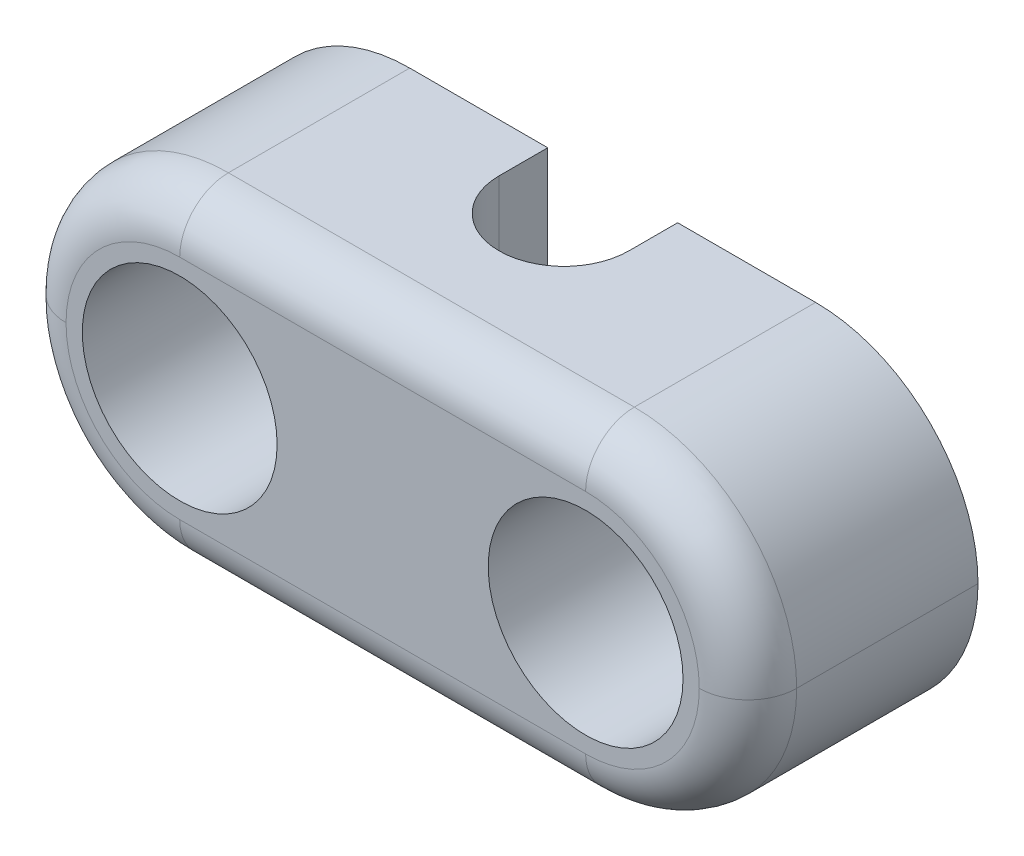
from build123d import *

# Parameters (mm, degrees)
SKETCH2_W                               = 45
SKETCH2_H                               = 20
BOSS_EXTRUDE2_DEPTH                     = 14.16787265
FILLET1_R                               = 10
CUT_EXTRUDE1_DEPTH                      = 22
CBORE_FOR_M5_HEX_HEAD_BOLT1_D           = 5.5
CBORE_FOR_M5_HEX_HEAD_BOLT1_CBORE_D     = 12
CBORE_FOR_M5_HEX_HEAD_BOLT1_CBORE_DEPTH = 10
FILLET2_R                               = 3


with BuildPart() as part:
    # Sketch2 → Boss-Extrude2 (new body)
    with BuildSketch(Plane.XY):
        Rectangle(SKETCH2_W, SKETCH2_H)
    extrude(amount=BOSS_EXTRUDE2_DEPTH)

    # Fillet1
    fillet1_edges = [part.edges().sort_by_distance(p)[0] for p in [
        (22.5, 10, 7.083936325),
        (22.5, -10, 7.083936325),
        (-22.5, 10, 7.083936325),
        (-22.5, -10, 7.083936325),
    ]]
    fillet(fillet1_edges, radius=FILLET1_R - 0.0001)  # a hair under: the kernel refuses the full size

    # Sketch3 → Cut-Extrude1 (cut)
    with BuildSketch(Plane.XZ.offset(10)):
        with BuildLine():
            Line((-4, 0), (-4, 3))
            ThreePointArc((-4, 3), (0, 7), (4, 3))
            Line((4, 3), (4, 0))
            ThreePointArc((4, 0), (0, -4), (-4, 0))
        make_face()
    extrude(amount=-CUT_EXTRUDE1_DEPTH, mode=Mode.SUBTRACT)

    # CBORE for M5 Hex Head Bolt1 (through all)
    with Locations(Plane.XY.offset(14.16787265)):
        with Locations((-12.5, 0), (12.5, 0)):
            CounterBoreHole(CBORE_FOR_M5_HEX_HEAD_BOLT1_D / 2, CBORE_FOR_M5_HEX_HEAD_BOLT1_CBORE_D / 2, CBORE_FOR_M5_HEX_HEAD_BOLT1_CBORE_DEPTH)

    # Fillet2
    fillet2_edges = [part.edges().sort_by_distance(p)[0] for p in [
        (0, 10, 14.16787265),
        (0, -10, 14.16787265),
        (-19.571097101, -7.071097101, 14.16787265),
        (-19.571097101, 7.071097101, 14.16787265),
        (19.571097101, -7.071097101, 14.16787265),
        (19.571097101, 7.071097101, 14.16787265),
    ]]
    fillet(fillet2_edges, radius=FILLET2_R)


solid = part.part
